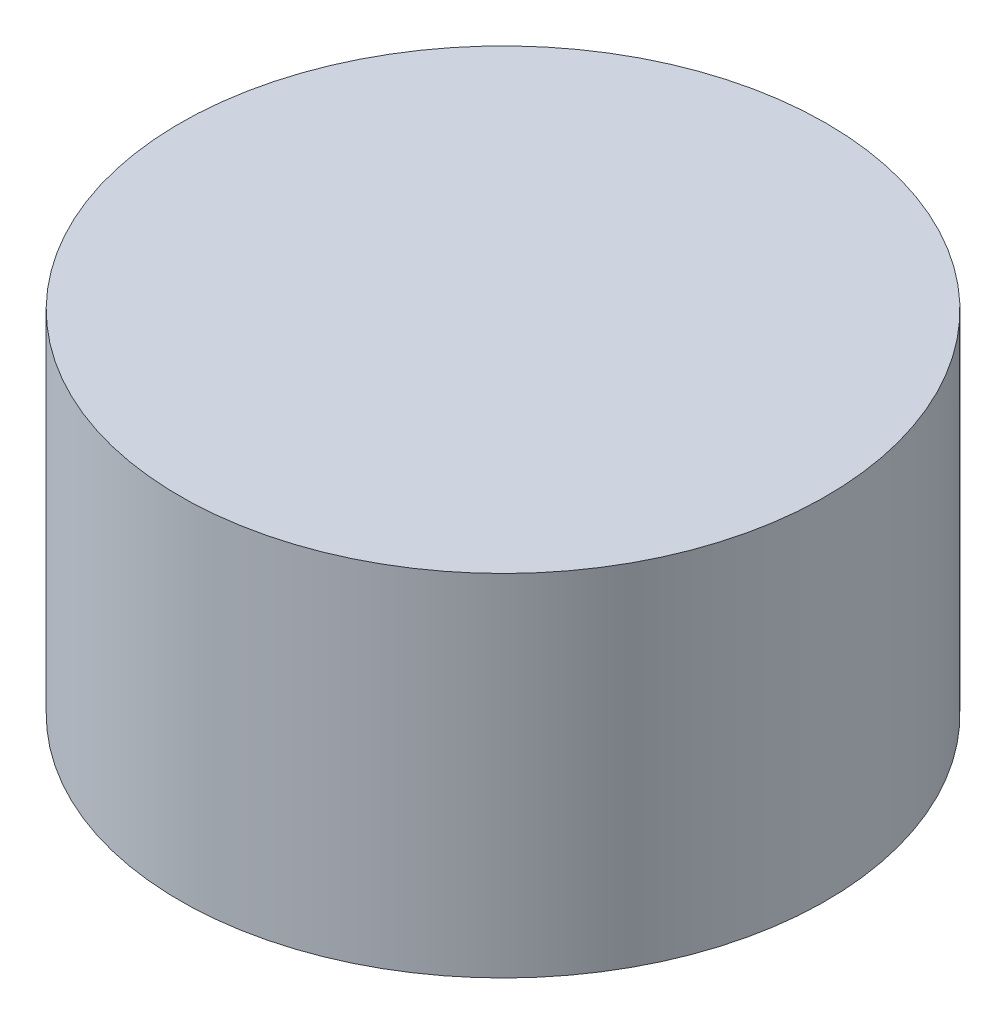
from build123d import *

# Parameters (mm, degrees)
SKETCH_1_R      = 41.5
EXTRUDE_1_DEPTH = 45


with BuildPart() as part:
    # 草圖1 → 填料-伸長1 (new body)
    with BuildSketch(Plane(origin=(0, 0, 0), x_dir=(1, 0, 0), z_dir=(0, 1, 0))):
        Circle(SKETCH_1_R)
    extrude(amount=EXTRUDE_1_DEPTH)


solid = part.part
